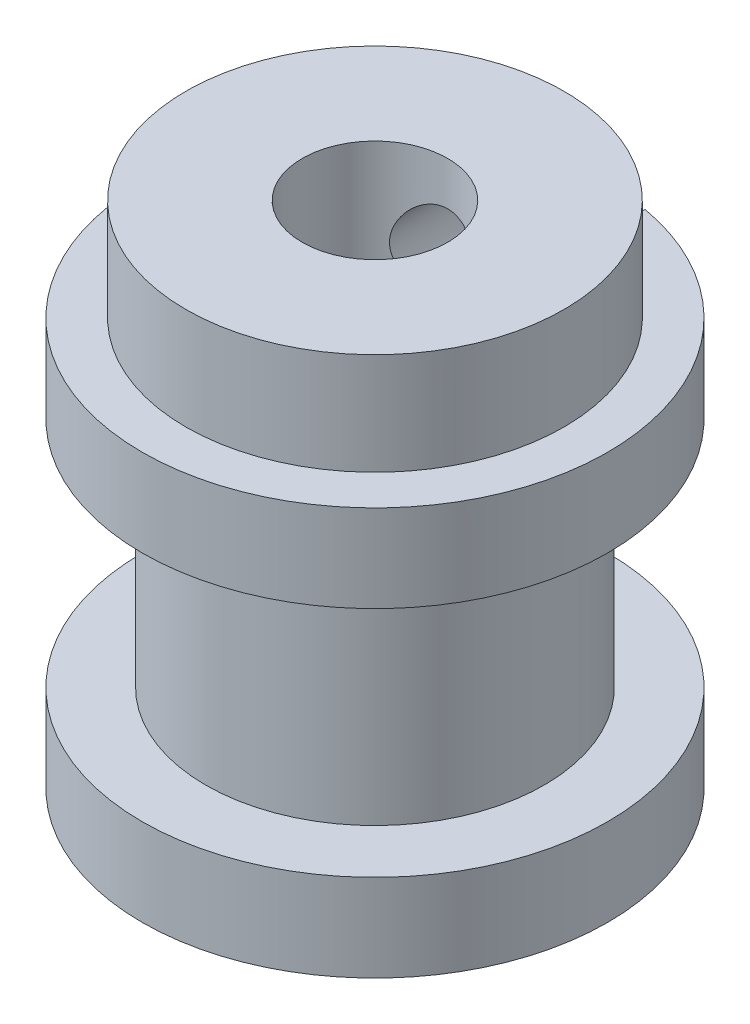
from build123d import *

# Parameters (mm, degrees)
ESQUISSE2_R             = 1.5
ENL_V_MAT_EXTRU_1_DEPTH = 16.43534904


with BuildPart() as part:
    # Esquisse1 → Révolution1 (revolve)
    with BuildSketch(Plane.XY):
        Polygon((2.5, -7), (2.5, 10.5), (6.5, 10.5), (6.5, 7), (8, 7), (8, 4), (5.82, 4), (5.82, -4), (8, -4), (8, -7), align=None)
    revolve(axis=Axis((0, 5.91926869, 0), (0, -1, 0)))

    # Esquisse2 → Enlèv. mat.-Extru.1 (cut, through all)
    with BuildSketch(Plane.XY):
        with Locations((0, 7.5)):
            Circle(ESQUISSE2_R)
    extrude(amount=-ENL_V_MAT_EXTRU_1_DEPTH, mode=Mode.SUBTRACT)


solid = part.part
